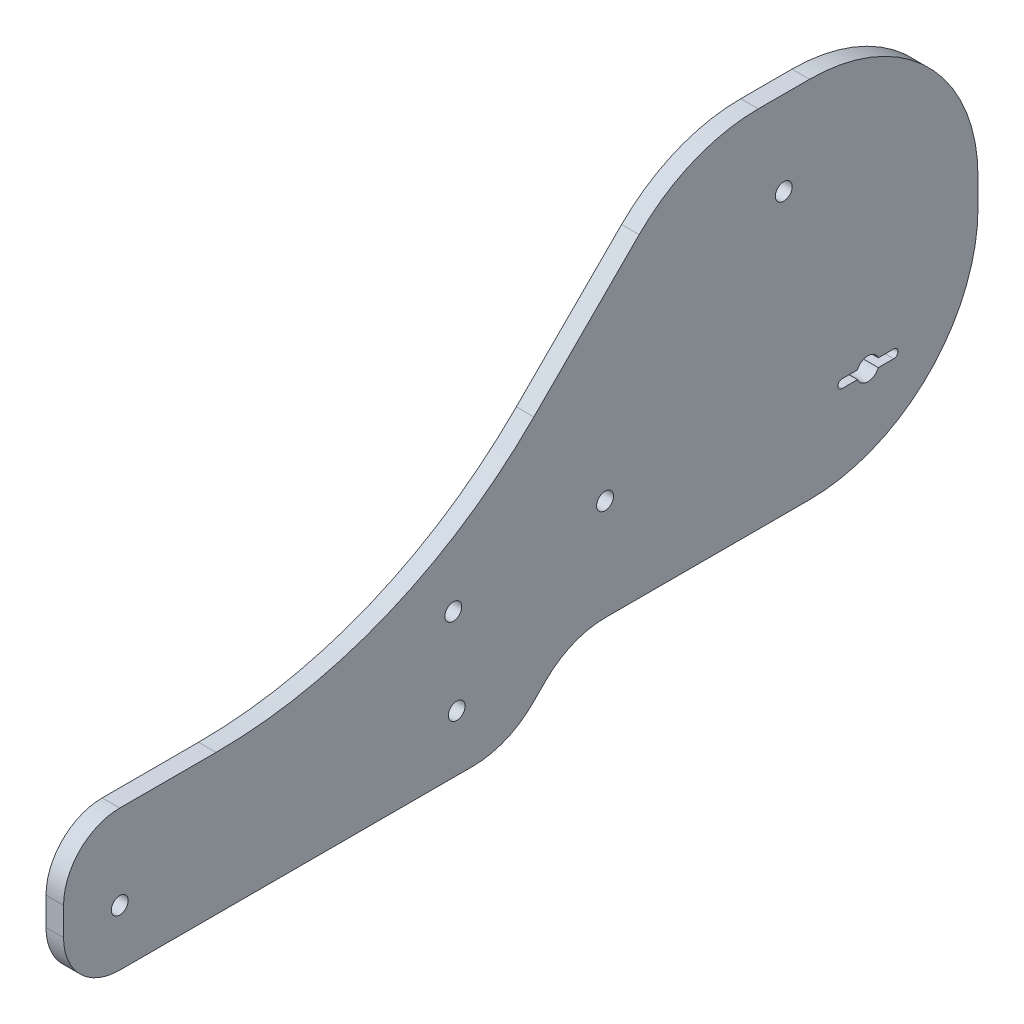
from build123d import *

# Parameters (mm, degrees)
SKETCH1_R           = 1.5
BOSS_EXTRUDE1_DEPTH = 3.125
FILLET1_R           = 10
FILLET2_R           = 15
FILLET3_R           = 30
FILLET4_R           = 30
FILLET5_R           = 80
FILLET6_R           = 30


with BuildPart() as part:
    # Sketch1 → Boss-Extrude1 (new body)
    with BuildSketch(Plane(origin=(0, 0, 0), x_dir=(0, 0, -1), z_dir=(1, 0, 0))):
        Polygon((-143.20422433, -1.13137085), (-143.20422433, -26.13137085), (-64.062088707, -26.13137085), (-52.930717857, -15), (19.6, -15), (19.6, 49.830569927), (-31.940768363, 49.830569927), (-82.90270914, -1.13137085), align=None)
        with Locations((-46.799347007, 3.010764774)):
            Circle(SKETCH1_R, mode=Mode.SUBTRACT)
        with Locations((-14.979541854, 34.830569927)):
            Circle(SKETCH1_R, mode=Mode.SUBTRACT)
        with Locations((-73.810826048, -0.524769132)):
            Circle(SKETCH1_R, mode=Mode.SUBTRACT)
        with Locations((-73.20422433, -16.13137085)):
            Circle(SKETCH1_R, mode=Mode.SUBTRACT)
        with Locations((-133.20422433, -16.13137085)):
            Circle(SKETCH1_R, mode=Mode.SUBTRACT)
        with BuildLine():
            Line((-4.6, 0.75), (-1.854049622, 0.75))
            ThreePointArc((-1.854049622, 0.75), (0, 2), (1.854049622, 0.75))
            Line((1.854049622, 0.75), (4.6, 0.75))
            ThreePointArc((4.6, 0.75), (5.35, 0), (4.6, -0.75))
            Line((4.6, -0.75), (1.854049622, -0.75))
            ThreePointArc((1.854049622, -0.75), (0, -2), (-1.854049622, -0.75))
            Line((-1.854049622, -0.75), (-4.6, -0.75))
            ThreePointArc((-4.6, -0.75), (-5.35, 0), (-4.6, 0.75))
        make_face(mode=Mode.SUBTRACT)
    extrude(amount=BOSS_EXTRUDE1_DEPTH)

    # Fillet1
    fillet1_edges = [part.edges().sort_by_distance(p)[0] for p in [
        (1.5625, -1.13137085, 143.20422433),
        (1.5625, -26.13137085, 143.20422433),
    ]]
    fillet(fillet1_edges, radius=FILLET1_R)

    # Fillet2
    fillet2_edges = [part.edges().sort_by_distance(p)[0] for p in [
        (1.5625, -26.13137085, 64.062088707),
        (1.5625, -15, 52.930717857),
    ]]
    fillet(fillet2_edges, radius=FILLET2_R)

    # Fillet3
    fillet3_edges = [part.edges().sort_by_distance(p)[0] for p in [
        (1.5625, -15, -19.6),
    ]]
    fillet(fillet3_edges, radius=FILLET3_R)

    # Fillet4
    fillet4_edges = [part.edges().sort_by_distance(p)[0] for p in [
        (1.5625, 49.830569927, 31.940768363),
    ]]
    fillet(fillet4_edges, radius=FILLET4_R)

    # Fillet5
    fillet5_edges = [part.edges().sort_by_distance(p)[0] for p in [
        (1.5625, -1.13137085, 82.90270914),
    ]]
    fillet(fillet5_edges, radius=FILLET5_R)

    # Fillet6
    fillet6_edges = [part.edges().sort_by_distance(p)[0] for p in [
        (1.5625, 49.830569927, -19.6),
    ]]
    fillet(fillet6_edges, radius=FILLET6_R)


solid = part.part
